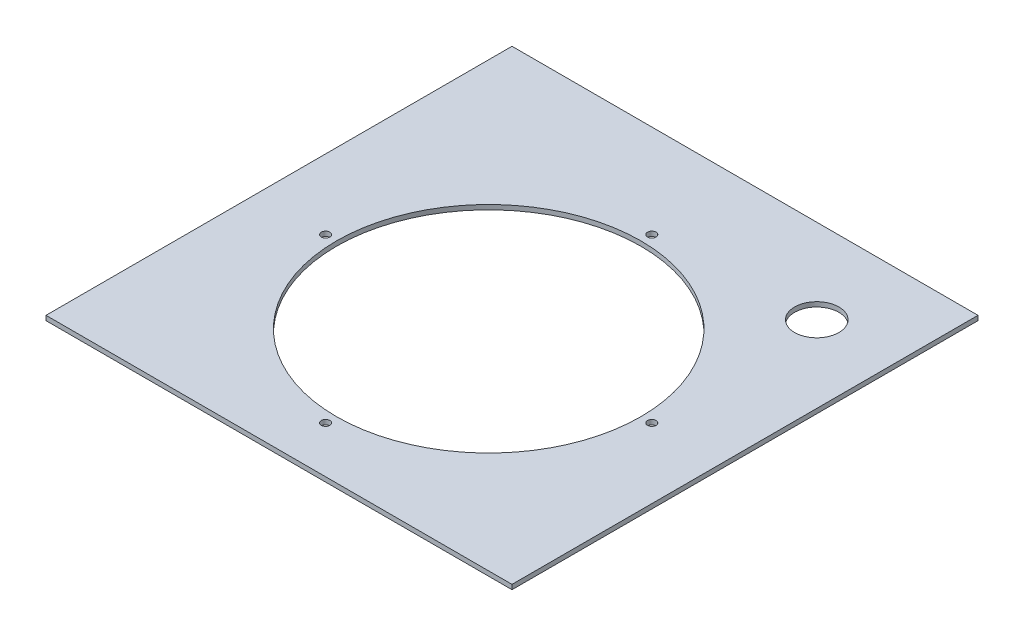
from build123d import *

# Parameters (mm, degrees)
SKETCH1_W           = 300
SKETCH1_H           = 330
BOSS_EXTRUDE1_DEPTH = 3
CUT_EXTRUDE1_REACH  = 447.992
SKETCH2_R           = 98
SKETCH2_R_2         = 14.255
SKETCH4_R           = 2.75
CUT_EXTRUDE3_DEPTH  = 446.992152397
SKETCH6_W           = 300
SKETCH6_H           = 30
CUT_EXTRUDE5_DEPTH  = 446.992152397


with BuildPart() as part:
    # Sketch1 → Boss-Extrude1 (new body)
    with BuildSketch(Plane(origin=(0, 0, 0), x_dir=(1, 0, 0), z_dir=(0, 1, 0))):
        with Locations((150, -165)):
            Rectangle(SKETCH1_W, SKETCH1_H)
    extrude(amount=BOSS_EXTRUDE1_DEPTH)

    # Sketch2 → Cut-Extrude1 (cut, up to next)
    with BuildSketch(Plane(origin=(0, 3, 0), x_dir=(1, 0, 0), z_dir=(0, 1, 0)), mode=Mode.PRIVATE) as cut_extrude1_sk1:
        with Locations((150, -165)):
            Circle(SKETCH2_R)
    cut_extrude1_tool1 = extrude(cut_extrude1_sk1.sketch, amount=-CUT_EXTRUDE1_REACH, mode=Mode.PRIVATE) & part.part
    # Sketch2 → Cut-Extrude1 (cut, up to next)
    with BuildSketch(Plane(origin=(0, 3, 0), x_dir=(1, 0, 0), z_dir=(0, 1, 0)), mode=Mode.PRIVATE) as cut_extrude1_sk2:
        with Locations((250.564582702, -54.378959027)):
            Circle(SKETCH2_R_2)
    cut_extrude1_tool2 = extrude(cut_extrude1_sk2.sketch, amount=-CUT_EXTRUDE1_REACH, mode=Mode.PRIVATE) & part.part
    add(cut_extrude1_tool1.solids().sort_by_distance((150, 3, 165))[0], mode=Mode.SUBTRACT)
    add(cut_extrude1_tool2.solids().sort_by_distance((250.564583, 3, 54.378959))[0], mode=Mode.SUBTRACT)

    # Sketch4 → Cut-Extrude3 (cut, through all)
    with BuildSketch(Plane(origin=(0, 3, 0), x_dir=(1, 0, 0), z_dir=(0, 1, 0))):
        with Locations((45, -165)):
            Circle(SKETCH4_R)
        with Locations((255, -165)):
            Circle(SKETCH4_R)
        with Locations((150, -270)):
            Circle(SKETCH4_R)
        with Locations((150, -60)):
            Circle(SKETCH4_R)
    extrude(amount=-CUT_EXTRUDE3_DEPTH, mode=Mode.SUBTRACT)

    # Sketch6 → Cut-Extrude5 (cut, through all)
    with BuildSketch(Plane(origin=(0, 3, 0), x_dir=(1, 0, 0), z_dir=(0, 1, 0))):
        with Locations((150, -315)):
            Rectangle(SKETCH6_W, SKETCH6_H)
    extrude(amount=-CUT_EXTRUDE5_DEPTH, mode=Mode.SUBTRACT)


solid = part.part
